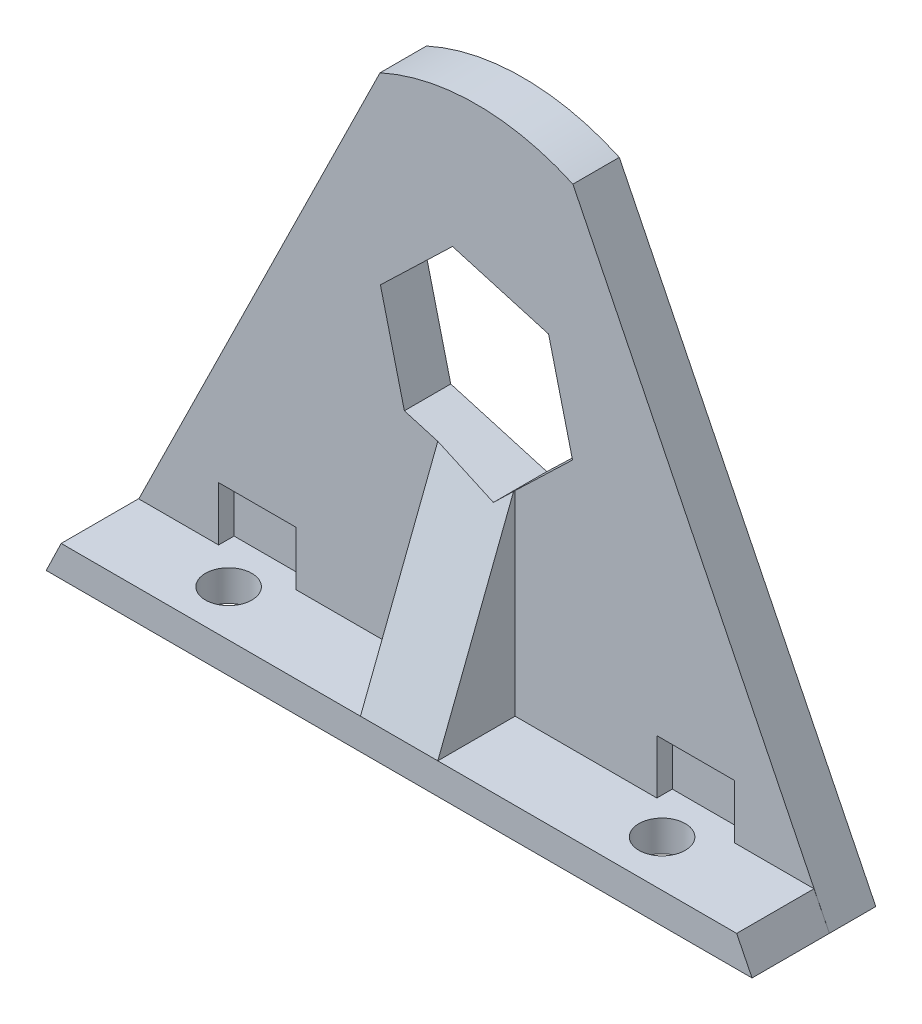
from build123d import *

# Parameters (mm, degrees)
SKETCH_1_R               = 3
EXTRUDE_1_DEPTH          = 2
EXTRUDE_2_DEPTH          = 6
RIB_2_REACH              = 42.702
SKETCH_3_WALL_W          = 109.004825052
SKETCH_3_WALL_H          = 5
SKETCH_4_R               = 4.101413307
EXTRUDE_3_DEPTH          = 2
EXTRUDE_4_DEPTH          = 3
CUT_EXTRUDE_1_DEPTH      = 41.220101475
CUT_EXTRUDE_1_DEPTH_BACK = 41.220101475
CUT_EXTRUDE_START        = -10
CUT_EXTRUDE_2_DEPTH      = 10
CUT_EXTRUDE_3_DEPTH      = 10
SKETCH_14_R              = 1.5
CUT_EXTRUDE_4_DEPTH      = 10
SKETCH_15_W              = 5.01110436
SKETCH_15_H              = 3.494287521
CUT_EXTRUDE_5_DEPTH      = 1


with BuildPart() as part:
    # 草图1 → 凸台-拉伸1 (new body)
    with BuildSketch(Plane.XY):
        with BuildLine():
            Line((-5.382175267, 2.651827558), (-22.819924686, -32.74))
            Line((-22.819924686, -32.74), (22.819924686, -32.74))
            Line((22.819924686, -32.74), (5.382175267, 2.651827558))
            ThreePointArc((5.382175267, 2.651827558), (0, 6), (-5.382175267, 2.651827558))
        make_face()
        Circle(SKETCH_1_R, mode=Mode.SUBTRACT)
    extrude(amount=EXTRUDE_1_DEPTH)

    # 草图2 → 凸台-拉伸2 (add)
    with BuildSketch(Plane.XY.offset(2)):
        Polygon((21.824193002, -30.74), (22.819924686, -32.74), (-22.819924686, -32.74), (-21.851665672, -30.74), align=None)
    extrude(amount=EXTRUDE_2_DEPTH)

    # 草图3 wall → 筋2 (add, up to next)
    with BuildSketch(Plane(origin=(0, -18.296150966, 5), x_dir=(0, -0.972147881588, 0.234368292061), z_dir=(0, -0.234368292061, -0.972147881588)), mode=Mode.PRIVATE) as rib_2_sk1:
        Rectangle(SKETCH_3_WALL_W, SKETCH_3_WALL_H)
    rib_2_tool1 = extrude(rib_2_sk1.sketch, amount=RIB_2_REACH, mode=Mode.PRIVATE) - part.part
    add(rib_2_tool1.solids().sort_by_distance((0, -18.296150966, 5))[0])

    # 草图4 → 凸台-拉伸3 (add)
    with BuildSketch(Plane.XY.offset(2)):
        Circle(SKETCH_4_R)
    extrude(amount=-EXTRUDE_3_DEPTH)

    # 草图9 → 凸台-拉伸4 (add)
    with BuildSketch(Plane(origin=(0, 0, 0), x_dir=(-1, 0, 0), z_dir=(0, 0, -1))):
        with BuildLine():
            Line((-6.23517922, 0.920562354), (-22.819924686, -32.74))
            Line((-22.819924686, -32.74), (22.819924686, -32.74))
            Line((22.819924686, -32.74), (6.23517922, 0.920562354))
            ThreePointArc((6.23517922, 0.920562354), (0, 2.276271965), (-6.23517922, 0.920562354))
        make_face()
        Polygon((6.21139304, -10.94224311), (4.662599656, -17.220345721), (-1.548793384, -19.018102611), (-6.21139304, -14.53775689), (-4.662599656, -8.259654279), (1.548793384, -6.461897389), align=None, mode=Mode.SUBTRACT)
    extrude(amount=-EXTRUDE_4_DEPTH)

    # 草图11 → 切除-拉伸1 (cut, two sides: drawn at the far end of the back side and taken through both)
    with BuildSketch(Plane.XY.offset(3).offset(-CUT_EXTRUDE_1_DEPTH_BACK)):
        Polygon((6.21139304, -14.53775689), (4.662599656, -8.259654279), (-1.548793384, -6.461897389), (-6.21139304, -10.94224311), (-4.662599656, -17.220345721), (1.548793384, -19.018102611), align=None)
    extrude(amount=CUT_EXTRUDE_1_DEPTH + CUT_EXTRUDE_1_DEPTH_BACK, mode=Mode.SUBTRACT)

    # 草图12 → 切除-拉伸2 (cut)
    with BuildSketch(Plane.XY.offset(3).offset(CUT_EXTRUDE_START)):
        with BuildLine():
            Line((14.504971028, 2.702486536), (10.280667783, -1.794850678))
            ThreePointArc((10.280667783, -1.794850678), (0.290112641, 2.273469232), (-9.850153994, -1.405852921))
            Line((-9.850153994, -1.405852921), (-13.409584794, 3.662670837))
            ThreePointArc((-13.409584794, 3.662670837), (0.728324257, 8.43390183), (14.504971028, 2.702486536))
        make_face()
    extrude(amount=CUT_EXTRUDE_2_DEPTH, mode=Mode.SUBTRACT)

    # 草图13 → 切除-拉伸3 (cut)
    with BuildSketch(Plane.ZY.offset(2.5)):
        Polygon((3, -17.846264642), (8, -30.74), (8, -17.846264642), (3.4065387, -17.846264642), align=None)
    extrude(amount=-CUT_EXTRUDE_3_DEPTH, mode=Mode.SUBTRACT)

    # 草图14 → 切除-拉伸4 (cut)
    with BuildSketch(Plane.XZ.offset(32.74)):
        with Locations((14.013848445, 5.011131475)):
            Circle(SKETCH_14_R)
        with Locations((-14.013847957, 5.011131475)):
            Circle(SKETCH_14_R)
    extrude(amount=-CUT_EXTRUDE_4_DEPTH, mode=Mode.SUBTRACT)

    # 草图15 → 切除-拉伸5 (cut)
    with BuildSketch(Plane.XY.offset(3)):
        with Locations((-14.168501734, -28.99285624)):
            Rectangle(SKETCH_15_W, SKETCH_15_H)
        with Locations((14.168501734, -28.99285624)):
            Rectangle(SKETCH_15_W, SKETCH_15_H)
    extrude(amount=-CUT_EXTRUDE_5_DEPTH, mode=Mode.SUBTRACT)


solid = part.part
